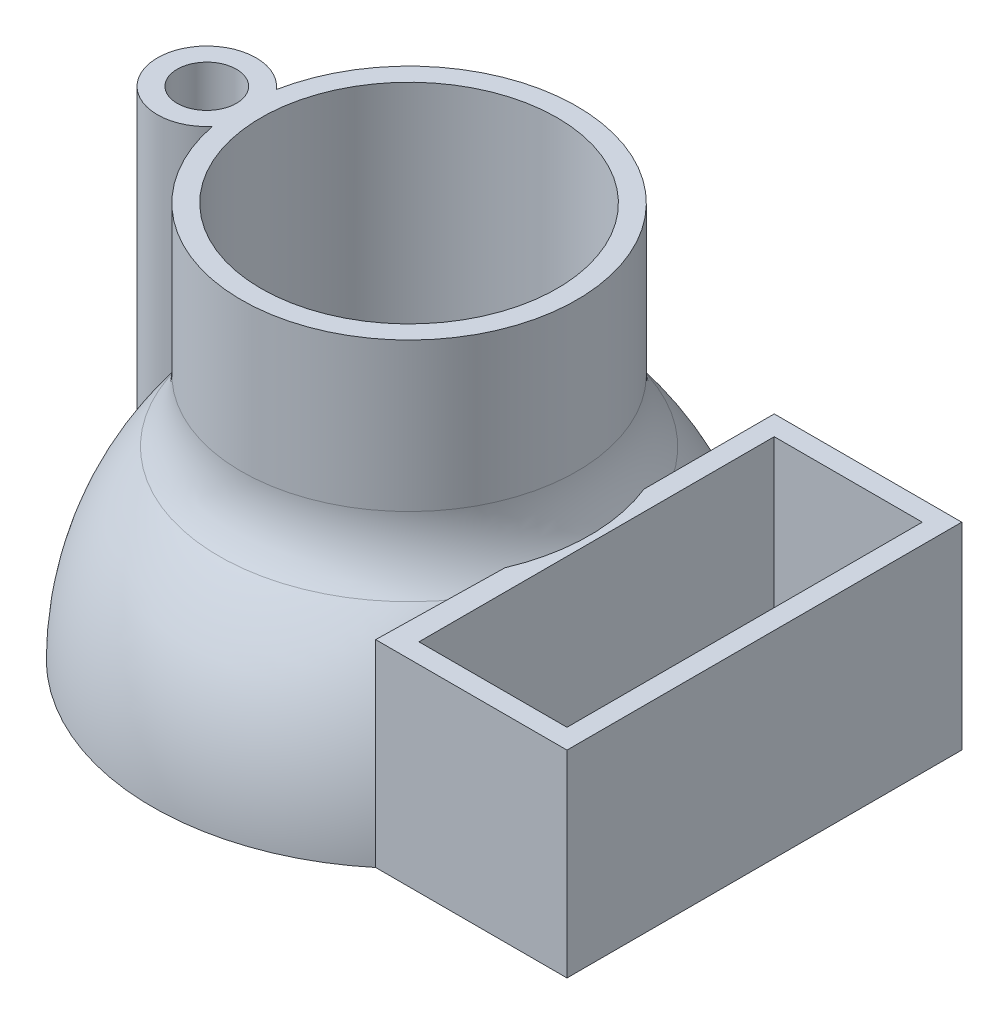
from build123d import *

# Parameters (mm, degrees)
SKETCH1_R               = 17
SKETCH1_R_2             = 15
BOSS_EXTRUDE1_DEPTH     = 40
SKETCH2_R               = 26
SKETCH2_R_2             = 15
BOSS_EXTRUDE2_DEPTH     = 15
FILLET1_R               = 10
BOSS_EXTRUDE4_REACH     = 56.331
SKETCH3_R               = 5
SKETCH3_R_2             = 3
CUT_EXTRUDE1_START      = -38
SKETCH4_R               = 3
CUT_EXTRUDE1_DEPTH      = 38
SKETCH5_R               = 15
BOSS_EXTRUDE5_DEPTH     = 2
BOSS_EXTRUDE10_START    = -40
SKETCH13_W              = 15
SKETCH13_H              = 36
BOSS_EXTRUDE10_DEPTH    = 20
CUT_EXTRUDE4_DEPTH      = 49.702222157
CUT_EXTRUDE4_DEPTH_BACK = 49.702222157
SKETCH14_W              = 15
SKETCH14_H              = 36
SKETCH15_W              = 15
SKETCH15_H              = 36
BOSS_EXTRUDE11_DEPTH    = 2


with BuildPart() as part:
    # Sketch1 → Boss-Extrude1 (new body)
    with BuildSketch(Plane(origin=(0, 0, 0), x_dir=(1, 0, 0), z_dir=(0, 1, 0))):
        with Locations(Location((0, 0, 0), (0, 0, 270))):
            Circle(SKETCH1_R)
        with Locations(Location((0, 0, 0), (0, 0, 270))):
            Circle(SKETCH1_R_2, mode=Mode.SUBTRACT)
    extrude(amount=BOSS_EXTRUDE1_DEPTH)

    # Sketch2 → Boss-Extrude2 (add)
    with BuildSketch(Plane.XZ):
        with Locations(Location((0, 0, 0), (0, 0, 270))):
            Circle(SKETCH2_R)
        with Locations(Location((0, 0, 0), (0, 0, 90))):
            Circle(SKETCH2_R_2, mode=Mode.SUBTRACT)
    extrude(amount=-BOSS_EXTRUDE2_DEPTH)

    # Fillet1
    # the kernel refuses this fillet: 10 mm, written as the material it adds along each edge
    with BuildSketch(Plane(origin=(0, 15, 0), x_dir=(0, 0, 1), z_dir=(1, 0, 0))) as fillet1_piece_1:
        with BuildLine():
            CenterArc((27, -9.949874371), FILLET1_R, 95.739170477, 84.260829523)
            Line((17, -9.949874371), (16.8, -9.949874371))
            Line((16.8, -9.949874371), (16.8, 0))
            Line((16.8, 0), (17, 0.2))
            ThreePointArc((17, 0.2), (21.5, 0.2), (25.98, 0.198997487))
            Line((25.98, 0.198997487), (26, 0))
        make_face()
    revolve(axis=Axis((0, 15, 0), (0, -1, 0)))

    # Fillet2: read off the stored shape, not the designer's step
    # Fillet2 outline → Fillet2 (revolve, cut)
    with BuildSketch(Plane.XY):
        with BuildLine():
            Line((25.998200588, 18.630262041), (19.25, 18.630262041))
            ThreePointArc((19.25, 18.630262041), (24.206637205, 9.888353044), (25.998200588, 0))
            Line((25.998200588, 0), (25.998200588, 18.630262041))
        make_face()
    revolve(axis=Axis((0, 0, 0), (0, 1, 0)), mode=Mode.SUBTRACT)

    # Fillet2 2 outline → Fillet2 2 (revolve, cut)
    with BuildSketch(Plane.XY):
        with BuildLine():
            Line((26, 0), (26, 15))
            ThreePointArc((26, 15), (25.999100287, 15.000090466), (25.998200582, 15.000181013))
            Line((25.998200582, 15.000181013), (25.998200588, 0))
            Line((25.998200588, 0), (26, 0))
        make_face()
    revolve(axis=Axis((0, 0, 0), (0, 1, 0)), mode=Mode.SUBTRACT)

    # Boss-Extrude4: up to this face of the body (flat: up to its plane)
    boss_extrude4_end = Plane(part.part.faces().sort_by_distance((0, 40, -16.519167389))[0])
    # Sketch3 → Boss-Extrude4 (add, up to the picked face)
    with BuildSketch(Plane.XZ, mode=Mode.PRIVATE) as boss_extrude4_sk1:
        with Locations((-20.499100294, 0)):
            Circle(SKETCH3_R)
        with Locations(Location((-20.499100294, 0, 0), (0, 0, 298.480209609))):
            Circle(SKETCH3_R_2, mode=Mode.SUBTRACT)
    boss_extrude4_tool1 = split(extrude(boss_extrude4_sk1.sketch, amount=-BOSS_EXTRUDE4_REACH, mode=Mode.PRIVATE), bisect_by=boss_extrude4_end, keep=Keep.BOTH, mode=Mode.PRIVATE)
    add(boss_extrude4_tool1.solids().sort_by(Axis((-25.357679, 0, 0), (0, 1, 0)))[0])

    # Sketch4 → Cut-Extrude1 (cut)
    with BuildSketch(Plane(origin=(0, 40, 0), x_dir=(1, 0, 0), z_dir=(0, 1, 0)).offset(CUT_EXTRUDE1_START)):
        with Locations(Location((-20.499100294, 0, 0), (0, 0, 270))):
            Circle(SKETCH4_R)
    extrude(amount=CUT_EXTRUDE1_DEPTH, mode=Mode.SUBTRACT)

    # Sketch5 → Boss-Extrude5 (add)
    with BuildSketch(Plane.XZ):
        with Locations(Location((0, 0, 0), (0, 0, 270))):
            Circle(SKETCH5_R)
    extrude(amount=-BOSS_EXTRUDE5_DEPTH)

    # Sketch13 → Boss-Extrude10 (add)
    with BuildSketch(Plane(origin=(0, 40, 0), x_dir=(1, 0, 0), z_dir=(0, 1, 0)).offset(BOSS_EXTRUDE10_START)):
        Polygon((17, 0), (17, 20), (36, 20), (36, -20), (16.610431475, -20), align=None)
        with Locations((26.5, 0)):
            Rectangle(SKETCH13_W, SKETCH13_H, mode=Mode.SUBTRACT)
    extrude(amount=BOSS_EXTRUDE10_DEPTH)

    # Sketch14 → Cut-Extrude4 (cut, two sides: drawn at the far end of the back side and taken through both)
    with BuildSketch(Plane(origin=(0, 20, 0), x_dir=(1, 0, 0), z_dir=(0, 1, 0)).offset(-CUT_EXTRUDE4_DEPTH_BACK)):
        with Locations((26.5, 0)):
            Rectangle(SKETCH14_W, SKETCH14_H)
    extrude(amount=CUT_EXTRUDE4_DEPTH + CUT_EXTRUDE4_DEPTH_BACK, mode=Mode.SUBTRACT)

    # Sketch15 → Boss-Extrude11 (add)
    with BuildSketch(Plane.XZ):
        with Locations((26.5, 0)):
            Rectangle(SKETCH15_W, SKETCH15_H)
    extrude(amount=-BOSS_EXTRUDE11_DEPTH)


solid = part.part
